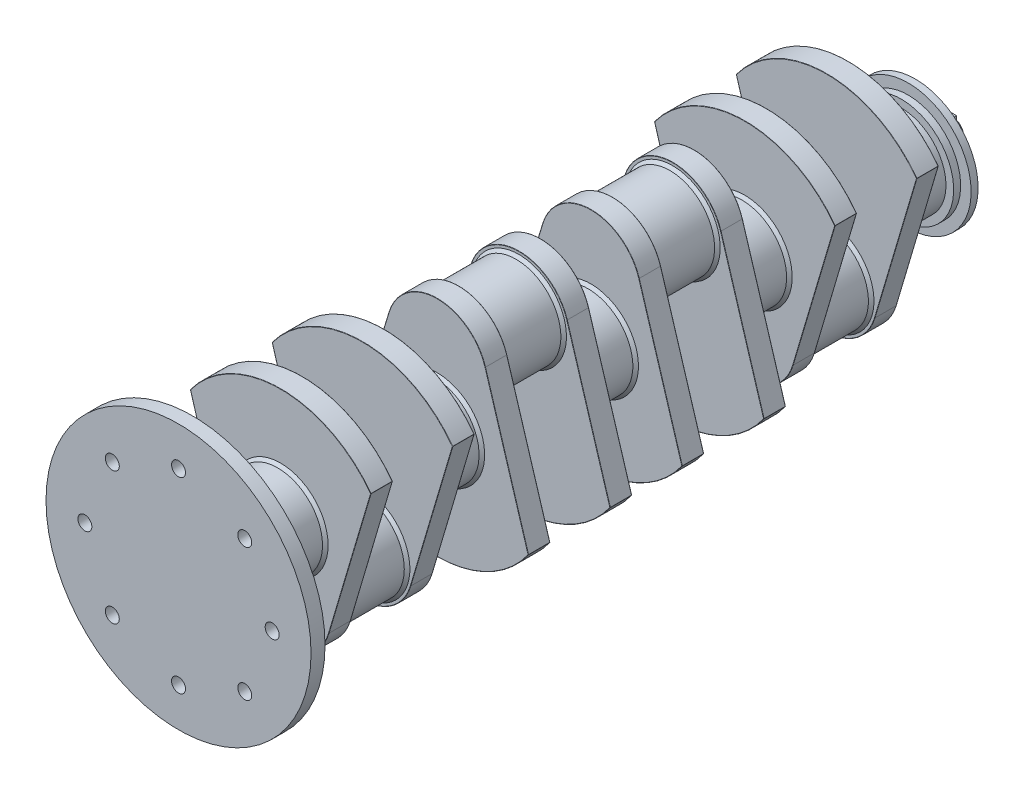
from build123d import *

# Parameters (mm, degrees)
SALIENTE_EXTRUIR1_DEPTH  = 15.5
CROQUIS2_R               = 32
SALIENTE_EXTRUIR2_DEPTH  = 43
SALIENTE_EXTRUIR3_START  = 15.5
SALIENTE_EXTRUIR3_DEPTH  = 15.5
CROQUIS4_R               = 32
SALIENTE_EXTRUIR4_DEPTH  = 38
SALIENTE_EXTRUIR5_START  = 15.5
SALIENTE_EXTRUIR5_DEPTH  = 15.5
CROQUIS7_R               = 32
SALIENTE_EXTRUIR6_DEPTH  = 43
SALIENTE_EXTRUIR7_START  = 15.5
SALIENTE_EXTRUIR7_DEPTH  = 15.5
CROQUIS9_R               = 32
SALIENTE_EXTRUIR8_DEPTH  = 36
SALIENTE_EXTRUIR9_START  = 15.5
SALIENTE_EXTRUIR9_DEPTH  = 15.5
CROQUIS11_R              = 32
SALIENTE_EXTRUIR10_DEPTH = 43
SALIENTE_EXTRUIR11_START = 15.5
SALIENTE_EXTRUIR11_DEPTH = 15.5
CROQUIS13_R              = 32
SALIENTE_EXTRUIR12_DEPTH = 36
SALIENTE_EXTRUIR13_START = 15.5
SALIENTE_EXTRUIR13_DEPTH = 15.5
CROQUIS15_R              = 32
SALIENTE_EXTRUIR14_DEPTH = 43
SALIENTE_EXTRUIR15_START = 15.5
SALIENTE_EXTRUIR15_DEPTH = 15.5
CROQUIS17_R              = 32
SALIENTE_EXTRUIR16_DEPTH = 43
CROQUIS18_R              = 37.5
SALIENTE_EXTRUIR17_DEPTH = 5
CROQUIS19_R              = 45
SALIENTE_EXTRUIR18_DEPTH = 5
CROQUIS20_R              = 7.625
SALIENTE_EXTRUIR19_DEPTH = 27
SALIENTE_EXTRUIR20_DEPTH = 27
SALIENTE_EXTRUIR21_START = 38
CROQUIS22_R              = 32
SALIENTE_EXTRUIR21_DEPTH = 38
CROQUIS23_R              = 25
SALIENTE_EXTRUIR22_DEPTH = 10
SALIENTE_EXTRUIR23_START = 15
CROQUIS24_R              = 45
SALIENTE_EXTRUIR23_DEPTH = 15
CROQUIS25_R              = 94.8
CROQUIS25_R_2            = 5
SALIENTE_EXTRUIR24_DEPTH = 10
CHAFL_N1_SIZE            = 2
REDONDEO1_R              = 0.2
REDONDEO2_R              = 0.2


# Read off the part's stored shape, not the designer's step: TaladroAvanzado1
with BuildPart() as part:
    # Croquis1 → Saliente-Extruir1 (new body)
    with BuildSketch(Plane.XY):
        with BuildLine():
            Line((-34.517510455, -10.224552409), (-64.569893475, 91.23059238))
            ThreePointArc((-64.569893475, 91.23059238), (0, 124), (64.569893475, 91.23059238))
            Line((64.569893475, 91.23059238), (34.517510455, -10.224552409))
            ThreePointArc((34.517510455, -10.224552409), (0, -36), (-34.517510455, -10.224552409))
        make_face()
    extrude(amount=SALIENTE_EXTRUIR1_DEPTH)

    # Croquis2 → Saliente-Extruir2 (add)
    with BuildSketch(Plane(origin=(0, 0, 0), x_dir=(-1, 0, 0), z_dir=(0, 0, -1))):
        Circle(CROQUIS2_R)
    extrude(amount=SALIENTE_EXTRUIR2_DEPTH)

    # Croquis3 → Saliente-Extruir3 (add)
    with BuildSketch(Plane(origin=(0, 0, -43), x_dir=(-1, 0, 0), z_dir=(0, 0, -1)).offset(SALIENTE_EXTRUIR3_START)):
        with BuildLine():
            Line((34.517510455, -10.224552409), (64.569893475, 91.23059238))
            ThreePointArc((64.569893475, 91.23059238), (0, 124), (-64.569893475, 91.23059238))
            Line((-64.569893475, 91.23059238), (-34.517510455, -10.224552409))
            ThreePointArc((-34.517510455, -10.224552409), (0, -36), (34.517510455, -10.224552409))
        make_face()
    extrude(amount=-SALIENTE_EXTRUIR3_DEPTH)

    # Croquis4 → Saliente-Extruir4 (add)
    with BuildSketch(Plane(origin=(0, 0, -58.5), x_dir=(-1, 0, 0), z_dir=(0, 0, -1))):
        with Locations((0, 44)):
            Circle(CROQUIS4_R)
    extrude(amount=SALIENTE_EXTRUIR4_DEPTH)

    # Croquis5 → Saliente-Extruir5 (add)
    with BuildSketch(Plane(origin=(0, 0, -96.5), x_dir=(-1, 0, 0), z_dir=(0, 0, -1)).offset(SALIENTE_EXTRUIR5_START)):
        with BuildLine():
            Line((-34.426971215, 98.52538137), (-65.248775575, -2.288198128))
            ThreePointArc((-65.248775575, -2.288198128), (0, -36), (65.248775575, -2.288198128))
            Line((65.248775575, -2.288198128), (34.426971215, 98.52538137))
            ThreePointArc((34.426971215, 98.52538137), (0, 124), (-34.426971215, 98.52538137))
        make_face()
    extrude(amount=-SALIENTE_EXTRUIR5_DEPTH)

    # Croquis7 → Saliente-Extruir6 (add)
    with BuildSketch(Plane(origin=(0, 0, -112), x_dir=(-1, 0, 0), z_dir=(0, 0, -1))):
        with Locations((0, 88)):
            Circle(CROQUIS7_R)
    extrude(amount=SALIENTE_EXTRUIR6_DEPTH)

    # Croquis8 → Saliente-Extruir7 (add)
    with BuildSketch(Plane(origin=(0, 0, -155), x_dir=(-1, 0, 0), z_dir=(0, 0, -1)).offset(SALIENTE_EXTRUIR7_START)):
        with BuildLine():
            Line((-34.426971215, 98.52538137), (-65.248775575, -2.288198128))
            ThreePointArc((-65.248775575, -2.288198128), (0, -36), (65.248775575, -2.288198128))
            Line((65.248775575, -2.288198128), (34.426971215, 98.52538137))
            ThreePointArc((34.426971215, 98.52538137), (0, 124), (-34.426971215, 98.52538137))
        make_face()
    extrude(amount=-SALIENTE_EXTRUIR7_DEPTH)

    # Croquis9 → Saliente-Extruir8 (add)
    with BuildSketch(Plane(origin=(0, 0, -170.5), x_dir=(-1, 0, 0), z_dir=(0, 0, -1))):
        with Locations((0, 44)):
            Circle(CROQUIS9_R)
    extrude(amount=SALIENTE_EXTRUIR8_DEPTH)

    # Croquis10 → Saliente-Extruir9 (add)
    with BuildSketch(Plane(origin=(0, 0, -206.5), x_dir=(-1, 0, 0), z_dir=(0, 0, -1)).offset(SALIENTE_EXTRUIR9_START)):
        with BuildLine():
            Line((-34.426971215, 98.52538137), (-65.248775575, -2.288198128))
            ThreePointArc((-65.248775575, -2.288198128), (0, -36), (65.248775575, -2.288198128))
            Line((65.248775575, -2.288198128), (34.426971215, 98.52538137))
            ThreePointArc((34.426971215, 98.52538137), (0, 124), (-34.426971215, 98.52538137))
        make_face()
    extrude(amount=-SALIENTE_EXTRUIR9_DEPTH)

    # Croquis11 → Saliente-Extruir10 (add)
    with BuildSketch(Plane(origin=(0, 0, -222), x_dir=(-1, 0, 0), z_dir=(0, 0, -1))):
        with Locations((0, 88)):
            Circle(CROQUIS11_R)
    extrude(amount=SALIENTE_EXTRUIR10_DEPTH)

    # Croquis12 → Saliente-Extruir11 (add)
    with BuildSketch(Plane(origin=(0, 0, -265), x_dir=(-1, 0, 0), z_dir=(0, 0, -1)).offset(SALIENTE_EXTRUIR11_START)):
        with BuildLine():
            Line((-34.426971215, 98.52538137), (-65.248775575, -2.288198128))
            ThreePointArc((-65.248775575, -2.288198128), (0, -36), (65.248775575, -2.288198128))
            Line((65.248775575, -2.288198128), (34.426971215, 98.52538137))
            ThreePointArc((34.426971215, 98.52538137), (0, 124), (-34.426971215, 98.52538137))
        make_face()
    extrude(amount=-SALIENTE_EXTRUIR11_DEPTH)

    # Croquis13 → Saliente-Extruir12 (add)
    with BuildSketch(Plane(origin=(0, 0, -280.5), x_dir=(-1, 0, 0), z_dir=(0, 0, -1))):
        with Locations((0, 44)):
            Circle(CROQUIS13_R)
    extrude(amount=SALIENTE_EXTRUIR12_DEPTH)

    # Croquis14 → Saliente-Extruir13 (add)
    with BuildSketch(Plane(origin=(0, 0, -316.5), x_dir=(-1, 0, 0), z_dir=(0, 0, -1)).offset(SALIENTE_EXTRUIR13_START)):
        with BuildLine():
            Line((34.517510455, -10.224552409), (64.569893475, 91.23059238))
            ThreePointArc((64.569893475, 91.23059238), (0, 124), (-64.569893475, 91.23059238))
            Line((-64.569893475, 91.23059238), (-34.517510455, -10.224552409))
            ThreePointArc((-34.517510455, -10.224552409), (0, -36), (34.517510455, -10.224552409))
        make_face()
    extrude(amount=-SALIENTE_EXTRUIR13_DEPTH)

    # Croquis15 → Saliente-Extruir14 (add)
    with BuildSketch(Plane(origin=(0, 0, -332), x_dir=(-1, 0, 0), z_dir=(0, 0, -1))):
        Circle(CROQUIS15_R)
    extrude(amount=SALIENTE_EXTRUIR14_DEPTH)

    # Croquis16 → Saliente-Extruir15 (add)
    with BuildSketch(Plane(origin=(0, 0, -375), x_dir=(-1, 0, 0), z_dir=(0, 0, -1)).offset(SALIENTE_EXTRUIR15_START)):
        with BuildLine():
            Line((34.517510455, -10.224552409), (64.569893475, 91.23059238))
            ThreePointArc((64.569893475, 91.23059238), (0, 124), (-64.569893475, 91.23059238))
            Line((-64.569893475, 91.23059238), (-34.517510455, -10.224552409))
            ThreePointArc((-34.517510455, -10.224552409), (0, -36), (34.517510455, -10.224552409))
        make_face()
    extrude(amount=-SALIENTE_EXTRUIR15_DEPTH)

    # Croquis17 → Saliente-Extruir16 (add)
    with BuildSketch(Plane(origin=(0, 0, -390.5), x_dir=(-1, 0, 0), z_dir=(0, 0, -1))):
        with Locations((0, 44)):
            Circle(CROQUIS17_R)
    extrude(amount=SALIENTE_EXTRUIR16_DEPTH)

    # Croquis18 → Saliente-Extruir17 (add)
    with BuildSketch(Plane(origin=(0, 0, -433.5), x_dir=(-1, 0, 0), z_dir=(0, 0, -1))):
        with Locations((0, 44)):
            Circle(CROQUIS18_R)
    extrude(amount=-SALIENTE_EXTRUIR17_DEPTH)

    # Croquis19 → Saliente-Extruir18 (add)
    with BuildSketch(Plane(origin=(0, 0, -433.5), x_dir=(-1, 0, 0), z_dir=(0, 0, -1))):
        with Locations((0, 44)):
            Circle(CROQUIS19_R)
    extrude(amount=SALIENTE_EXTRUIR18_DEPTH)

    # Croquis20 → Saliente-Extruir19 (add)
    with BuildSketch(Plane(origin=(0, 0, -438.5), x_dir=(-1, 0, 0), z_dir=(0, 0, -1))):
        with Locations((0, 44)):
            Circle(CROQUIS20_R)
    extrude(amount=SALIENTE_EXTRUIR19_DEPTH)

    # Croquis21 → Saliente-Extruir20 (add)
    with BuildSketch(Plane(origin=(0, 0, -438.5), x_dir=(-1, 0, 0), z_dir=(0, 0, -1))):
        with BuildLine():
            Line((2.5, 51.203514767), (2.5, 54.005475737))
            Line((2.5, 54.005475737), (-2.5, 54.005475737))
            Line((-2.5, 54.005475737), (-2.5, 51.203514767))
            ThreePointArc((-2.5, 51.203514767), (0, 51.625), (2.5, 51.203514767))
        make_face()
    extrude(amount=SALIENTE_EXTRUIR20_DEPTH)

    # Croquis22 → Saliente-Extruir21 (add)
    with BuildSketch(Plane.XY.offset(15.5).offset(SALIENTE_EXTRUIR21_START)):
        with Locations(Location((0, 44, 0), (0, 0, 180))):
            Circle(CROQUIS22_R)
    extrude(amount=-SALIENTE_EXTRUIR21_DEPTH)

    # Croquis23 → Saliente-Extruir22 (add)
    with BuildSketch(Plane.XY.offset(53.5)):
        with Locations((0, 44)):
            Circle(CROQUIS23_R)
    extrude(amount=SALIENTE_EXTRUIR22_DEPTH)

    # Croquis24 → Saliente-Extruir23 (add)
    with BuildSketch(Plane.XY.offset(63.5).offset(SALIENTE_EXTRUIR23_START)):
        with Locations(Location((0, 44, 0), (0, 0, 180))):
            Circle(CROQUIS24_R)
    extrude(amount=-SALIENTE_EXTRUIR23_DEPTH)

    # Croquis25 → Saliente-Extruir24 (add)
    with BuildSketch(Plane.XY.offset(78.5)):
        with Locations((0, 44)):
            Circle(CROQUIS25_R)
        with Locations((-67, 44)):
            Circle(CROQUIS25_R_2, mode=Mode.SUBTRACT)
        with Locations((-47.376154339, 91.376154339)):
            Circle(CROQUIS25_R_2, mode=Mode.SUBTRACT)
        with Locations((0, 111)):
            Circle(CROQUIS25_R_2, mode=Mode.SUBTRACT)
        with Locations((47.376154339, 91.376154339)):
            Circle(CROQUIS25_R_2, mode=Mode.SUBTRACT)
        with Locations((67, 44)):
            Circle(CROQUIS25_R_2, mode=Mode.SUBTRACT)
        with Locations((47.376154339, -3.376154339)):
            Circle(CROQUIS25_R_2, mode=Mode.SUBTRACT)
        with Locations((0, -23)):
            Circle(CROQUIS25_R_2, mode=Mode.SUBTRACT)
        with Locations((-47.376154339, -3.376154339)):
            Circle(CROQUIS25_R_2, mode=Mode.SUBTRACT)
    extrude(amount=SALIENTE_EXTRUIR24_DEPTH)

    # Chaflán1
    chafl_n1_edges = [part.edges().sort_by_distance(p)[0] for p in [
        (32, 0, -332),
        (32, 0, -375),
        (32, 44, -390.5),
        (32, 0, 0),
        (32, 0, -43),
        (32, 44, 15.5),
        (32, 44, 53.5),
        (32, 44, -58.5),
        (32, 44, -96.5),
        (32, 88, -112),
        (32, 88, -155),
        (32, 44, -170.5),
        (32, 44, -206.5),
        (32, 88, -222),
        (32, 88, -265),
        (32, 44, -280.5),
        (32, 44, -316.5),
    ]]
    chamfer(chafl_n1_edges, length=CHAFL_N1_SIZE)

    # Redondeo1
    redondeo1_edges = [part.edges().sort_by_distance(p)[0] for p in [
        (0, 124, 15.5),
        (-49.543701965, 40.503019985, 15.5),
        (0, -36, 15.5),
        (-49.543701965, 40.503019985, 0),
        (0, 124, 0),
        (49.543701965, 40.503019985, 0),
        (0, -36, 0),
        (49.543701965, 40.503019985, 15.5),
        (-64.569893475, 91.23059238, 7.75),
        (64.569893475, 91.23059238, 7.75),
    ]]
    fillet(redondeo1_edges, radius=REDONDEO1_R)

    # Redondeo2
    redondeo2_edges = [part.edges().sort_by_distance(p)[0] for p in [
        (0, -36, -375),
        (-49.543701965, 40.503019985, -375),
        (0, 124, -375),
        (-64.569893475, 91.23059238, -382.75),
        (49.543701965, 40.503019985, -375),
        (64.569893475, 91.23059238, -382.75),
        (0, -36, -390.5),
        (-49.543701965, 40.503019985, -390.5),
        (0, 124, -390.5),
        (49.543701965, 40.503019985, -390.5),
        (0, -36, -43),
        (-49.543701965, 40.503019985, -43),
        (0, 124, -43),
        (-64.569893475, 91.23059238, -50.75),
        (49.543701965, 40.503019985, -43),
        (64.569893475, 91.23059238, -50.75),
        (0, -36, -58.5),
        (-49.543701965, 40.503019985, -58.5),
        (0, 124, -58.5),
        (49.543701965, 40.503019985, -58.5),
        (0, 124, -96.5),
        (49.837873395, 48.118591621, -96.5),
        (0, -36, -96.5),
        (65.248775575, -2.288198128, -104.25),
        (-49.837873395, 48.118591621, -96.5),
        (-65.248775575, -2.288198128, -104.25),
        (0, 124, -112),
        (49.837873395, 48.118591621, -112),
        (0, -36, -112),
        (-49.837873395, 48.118591621, -112),
        (0, 124, -155),
        (49.837873395, 48.118591621, -155),
        (0, -36, -155),
        (65.248775575, -2.288198128, -162.75),
        (-49.837873395, 48.118591621, -155),
        (-65.248775575, -2.288198128, -162.75),
        (0, 124, -170.5),
        (49.837873395, 48.118591621, -170.5),
        (0, -36, -170.5),
        (-49.837873395, 48.118591621, -170.5),
        (0, 124, -206.5),
        (49.837873395, 48.118591621, -206.5),
        (0, -36, -206.5),
        (65.248775575, -2.288198128, -214.25),
        (-49.837873395, 48.118591621, -206.5),
        (-65.248775575, -2.288198128, -214.25),
        (0, 124, -222),
        (49.837873395, 48.118591621, -222),
        (0, -36, -222),
        (-49.837873395, 48.118591621, -222),
        (0, 124, -265),
        (49.837873395, 48.118591621, -265),
        (0, -36, -265),
        (65.248775575, -2.288198128, -272.75),
        (-49.837873395, 48.118591621, -265),
        (-65.248775575, -2.288198128, -272.75),
        (0, 124, -280.5),
        (49.837873395, 48.118591621, -280.5),
        (0, -36, -280.5),
        (-49.837873395, 48.118591621, -280.5),
        (0, -36, -316.5),
        (-49.543701965, 40.503019985, -316.5),
        (0, 124, -316.5),
        (-64.569893475, 91.23059238, -324.25),
        (49.543701965, 40.503019985, -316.5),
        (64.569893475, 91.23059238, -324.25),
        (0, -36, -332),
        (-49.543701965, 40.503019985, -332),
        (0, 124, -332),
        (49.543701965, 40.503019985, -332),
    ]]
    fillet(redondeo2_edges, radius=REDONDEO2_R)

    # TaladroAvanzado1 outline → TaladroAvanzado1 (revolve, cut)
    with BuildSketch(Plane.XZ.offset(-44)):
        Polygon((3.3, -465.5), (3.3, -415.5), (0, -413.517159957), (0, -465.5), align=None)
    revolve(axis=Axis((0, 44, 0), (0, 0, 1)), mode=Mode.SUBTRACT)


solid = part.part
